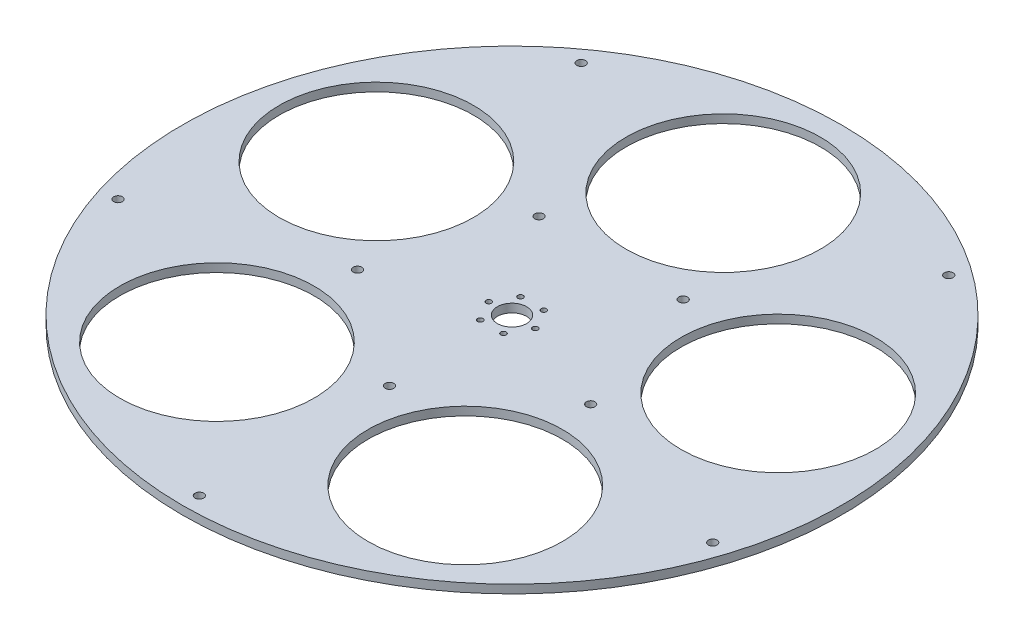
from build123d import *

# Parameters (mm, degrees)
SKETCH1_R              = 247.65
SKETCH1_R_2            = 73.025
BOSS_EXTRUDE1_DEPTH    = 6.35
SKETCH3_R              = 11
CUT_EXTRUDE1_DEPTH     = 356.689352873
F_10_32_TAPPED_HOLE1_D = 4.0386
SKETCH8_R              = 3.2512
CUT_EXTRUDE2_DEPTH     = 351.287549736
SKETCH9_R              = 3.2639
CUT_EXTRUDE3_DEPTH     = 351.287549736
CIRPATTERN1_COUNT      = 5


with BuildPart() as part:
    # Sketch1 → Boss-Extrude1 (new body)
    with BuildSketch(Plane(origin=(0, 0, 0), x_dir=(1, 0, 0), z_dir=(0, 1, 0))):
        Circle(SKETCH1_R)
        with Locations((0, 158.75)):
            Circle(SKETCH1_R_2, mode=Mode.SUBTRACT)
        with Locations((150.980221962, 49.056447857)):
            Circle(SKETCH1_R_2, mode=Mode.SUBTRACT)
        with Locations((93.310908801, -128.431447857)):
            Circle(SKETCH1_R_2, mode=Mode.SUBTRACT)
        with Locations((-93.310908801, -128.431447857)):
            Circle(SKETCH1_R_2, mode=Mode.SUBTRACT)
        with Locations((-150.980221962, 49.056447857)):
            Circle(SKETCH1_R_2, mode=Mode.SUBTRACT)
    extrude(amount=BOSS_EXTRUDE1_DEPTH)

    # Sketch3 → Cut-Extrude1 (cut, through all)
    with BuildSketch(Plane(origin=(-5.184519995, 6.35, -2.448578058), x_dir=(1, 0, 0), z_dir=(0, 1, 0))):
        with Locations((5.184519995, -2.448578058)):
            Circle(SKETCH3_R)
    extrude(amount=-CUT_EXTRUDE1_DEPTH, mode=Mode.SUBTRACT)

    # #10-32 Tapped Hole1 (through all)
    with Locations(Plane(origin=(-5.184519995, 6.35, -2.448578058), x_dir=(1, 0, 0), z_dir=(0, 1, 0))):
        with Locations((-3.546730005, 12.674390556), (13.915769995, 12.674390556), (22.647019995, -2.448578058), (13.915769995, -17.571546671), (-3.546730005, -17.571546671), (-12.277980005, -2.448578058)):
            Hole(F_10_32_TAPPED_HOLE1_D / 2)

    # Sketch8 → Cut-Extrude2 (cut, through all)
    with BuildSketch(Plane(origin=(0, 6.35, 0), x_dir=(1, 0, 0), z_dir=(0, 1, 0))):
        with Locations((0, -234.95)):
            Circle(SKETCH8_R)
        with Locations((-223.450728504, -72.603542828)):
            Circle(SKETCH8_R)
        with Locations((-138.100145026, 190.078542828)):
            Circle(SKETCH8_R)
        with Locations((138.100145026, 190.078542828)):
            Circle(SKETCH8_R)
        with Locations((223.450728504, -72.603542828)):
            Circle(SKETCH8_R)
    extrude(amount=-CUT_EXTRUDE2_DEPTH, mode=Mode.SUBTRACT)

    # Sketch9 → Cut-Extrude3 (cut, through all)
    with BuildSketch(Plane(origin=(0, 6.35, 0), x_dir=(1, 0, 0), z_dir=(0, 1, 0))):
        with Locations((0, -92.075)):
            Circle(SKETCH9_R)
    cut_extrude3 = extrude(amount=-CUT_EXTRUDE3_DEPTH, mode=Mode.SUBTRACT)

    # CirPattern1: Cut-Extrude3 ×5 about axis
    cirpattern1_axis = Axis((0, 6.35, 0), (0, 1, 0))
    for i in range(1, CIRPATTERN1_COUNT):
        add(cut_extrude3.rotate(cirpattern1_axis, i * 360 / CIRPATTERN1_COUNT), mode=Mode.SUBTRACT)


solid = part.part
